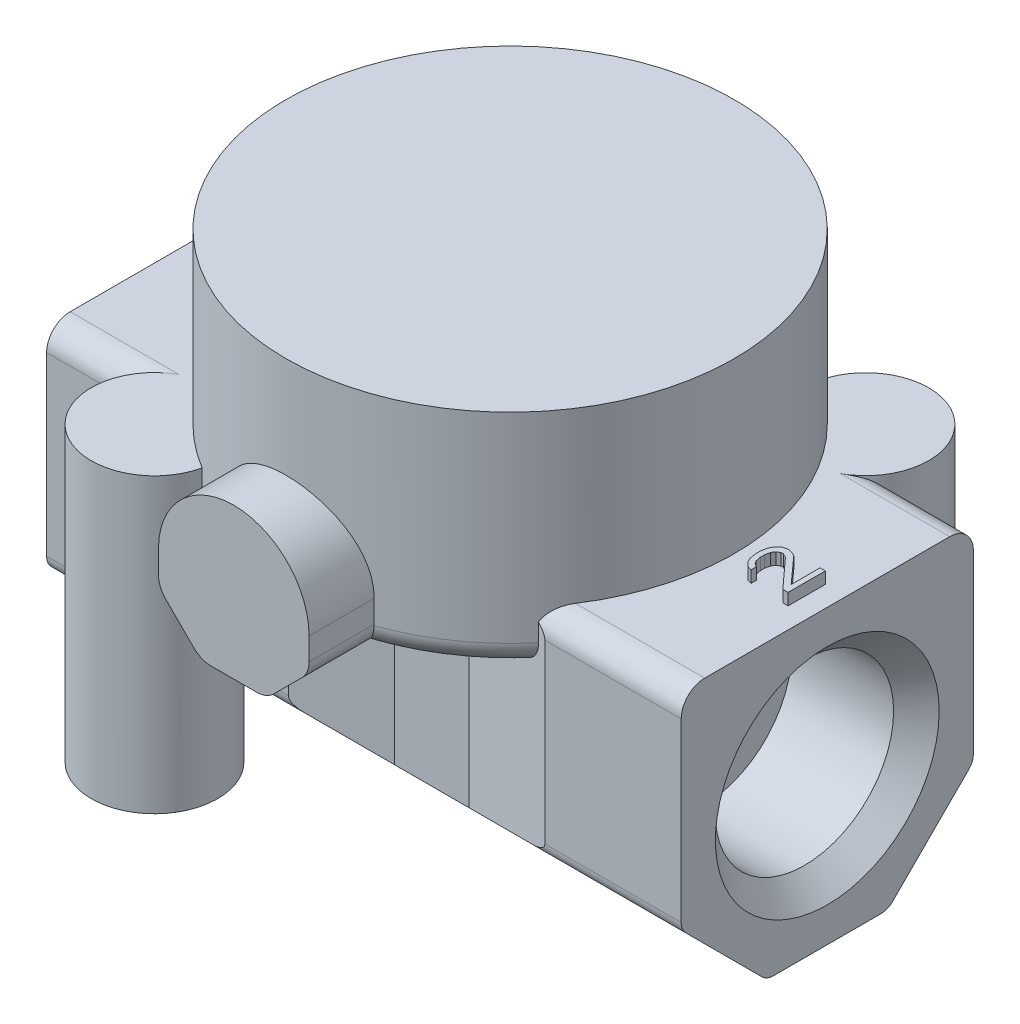
from build123d import *

# Parameters (mm, degrees)
BOSS_EXTRUDE1_DEPTH      = 39.612
CUT_EXTRUDE1_DEPTH       = 5.547195969
CUT_EXTRUDE1_DEPTH_BACK  = 5.547195969
CUT_EXTRUDE2_DEPTH       = 8.276160233
CUT_EXTRUDE2_DEPTH_BACK  = 8.276160233
SKETCH3_W                = 84.337272164
SKETCH3_H                = 65.415448281
SKETCH5_R                = 3.95
BOSS_EXTRUDE2_DEPTH      = 18.26969385
BOSS_EXTRUDE3_DEPTH      = 20
SKETCH7_R                = 3.937
BOSS_EXTRUDE4_DEPTH      = 18.26969385
BOSS_EXTRUDE5_DEPTH      = 0.7
BOSS_EXTRUDE5_DEPTH_BACK = 0.7
BOSS_EXTRUDE6_DEPTH      = 0.7
BOSS_EXTRUDE6_DEPTH_BACK = 0.7


with BuildPart() as part:
    # Sketch1 → Boss-Extrude1 (new body)
    with BuildSketch(Plane(origin=(19.8, 0, 0), x_dir=(0, 0, -1), z_dir=(1, 0, 0))):
        with BuildLine():
            Line((-8.826801422, -4.086394595), (-4.070394308, -8.842801555))
            ThreePointArc((-4.070394308, -8.842801555), (-3.745970956, -9.059574301), (-3.363287522, -9.135694762))
            Line((-3.363287522, -9.135694762), (3.363287818, -9.135694653))
            ThreePointArc((3.363287818, -9.135694653), (3.745971249, -9.059574179), (4.070394595, -8.842801423))
            Line((4.070394595, -8.842801423), (8.826801554, -4.086394309))
            ThreePointArc((8.826801554, -4.086394309), (9.043574313, -3.761970925), (9.119694762, -3.379287456))
            Line((9.119694762, -3.379287456), (9.119693846, 7.624000128))
            ThreePointArc((9.119693846, 7.624000128), (8.686301509, 8.6703016), (7.64, 9.10369385))
            Line((7.64, 9.10369385), (-7.650000004, 9.10369385))
            ThreePointArc((-7.650000004, 9.10369385), (-8.689230454, 8.673230525), (-9.119693854, 7.634000106))
            Line((-9.119693854, 7.634000106), (-9.119694652, -3.37928773))
            ThreePointArc((-9.119694652, -3.37928773), (-9.043574195, -3.761971209), (-8.826801422, -4.086394595))
        make_face()
    extrude(amount=-BOSS_EXTRUDE1_DEPTH)

    # Sketch2 → Cut-Extrude1 (cut, two sides: drawn at the far end of the back side and taken through both)
    with BuildSketch(Plane.XY.offset(-CUT_EXTRUDE1_DEPTH_BACK)):
        Polygon((-11.400000002, -16.447815487), (11.400000106, -16.447815487), (11.400000106, -9.166000001), (4.799999912, -7.366), (-4.8, -7.366), (-11.400000002, -9.166000001), align=None)
    extrude(amount=CUT_EXTRUDE1_DEPTH + CUT_EXTRUDE1_DEPTH_BACK, mode=Mode.SUBTRACT)

    # Sketch3 → Cut-Extrude2 (cut, two sides: drawn at the far end of the back side and taken through both)
    with BuildSketch(Plane(origin=(0, 0, 0), x_dir=(1, 0, 0), z_dir=(0, 1, 0)).offset(-CUT_EXTRUDE2_DEPTH_BACK)):
        with Locations((0.851814883, -0.975045123)):
            Rectangle(SKETCH3_W, SKETCH3_H)
        Polygon((-26.152859771, 16.921805373), (-26.152859771, -16.921805373), (0.145459355, -7.35), (4.799999991, -7.35), (30.199191541, -14.277051746), (30.199191541, 14.277052238), (4.8, 7.35), (0.145459355, 7.35), align=None, mode=Mode.SUBTRACT)
    extrude(amount=CUT_EXTRUDE2_DEPTH + CUT_EXTRUDE2_DEPTH_BACK, mode=Mode.SUBTRACT)

    # Sketch4 → Revolve1 (revolve)
    with BuildSketch(Plane(origin=(0, 0, 0), x_dir=(0, 0, -1), z_dir=(1, 0, 0)), mode=Mode.PRIVATE) as revolve1_sk:
        with BuildLine():
            Line((0, 19.65), (14.000000003, 19.65))
            Line((14.000000003, 19.65), (14.000000003, 7.149999997))
            ThreePointArc((14.000000003, 7.149999997), (13.560660172, 6.089339827), (12.5, 5.649999999))
            Line((12.5, 5.649999999), (0, 5.649999999))
            Line((0, 5.649999999), (0, 19.65))
        make_face()
    revolve(revolve1_sk.sketch.rotate(Axis((0, 5.649999999, 0), (0, 1, 0)), 180), axis=Axis((0, 5.649999999, 0), (0, 1, 0)))

    # Sketch5 → Boss-Extrude2 (add)
    with BuildSketch(Plane(origin=(0, -9.166, 0), x_dir=(-1, 0, 0), z_dir=(0, -1, 0))):
        with Locations(Location((11.1, -11.1, 0), (0, 0, 90))):
            Circle(SKETCH5_R)
    extrude(amount=-BOSS_EXTRUDE2_DEPTH)

    # Sketch6 → Boss-Extrude3 (add)
    with BuildSketch(Plane.XY.offset(17.25)):
        with BuildLine():
            Line((-4.7, 8.63), (-4.7, 7.231261469))
            ThreePointArc((-4.7, 7.231261469), (-4.583992408, 6.648051918), (-4.253630735, 6.153630735))
            Line((-4.253630735, 6.153630735), (-2.496369265, 4.396369265))
            ThreePointArc((-2.496369265, 4.396369265), (-2.001948082, 4.066007592), (-1.418738531, 3.95))
            Line((-1.418738531, 3.95), (1.418738531, 3.95))
            ThreePointArc((1.418738531, 3.95), (2.001948082, 4.066007592), (2.496369265, 4.396369265))
            Line((2.496369265, 4.396369265), (4.253630735, 6.153630735))
            ThreePointArc((4.253630735, 6.153630735), (4.583992408, 6.648051918), (4.7, 7.231261469))
            Line((4.7, 7.231261469), (4.7, 8.63))
            ThreePointArc((4.7, 8.63), (0, 13.350042553), (-4.7, 8.63))
        make_face()
    extrude(amount=-BOSS_EXTRUDE3_DEPTH)


with BuildPart() as boss_extrude4_tool:
    # Sketch7 → Boss-Extrude4 (new body)
    with BuildSketch(Plane(origin=(0, -9.166, 0), x_dir=(-1, 0, 0), z_dir=(0, -1, 0))):
        with Locations(Location((-11.1, 11.1, 0), (0, 0, 90))):
            Circle(SKETCH7_R)
    extrude(amount=-BOSS_EXTRUDE4_DEPTH)


with BuildPart() as part_1:
    add(part.part)


with BuildPart() as part_2:
    # Boss-Extrude4: joined with boss_extrude4_tool
    add(part_1.part.fuse(boss_extrude4_tool.part, tol=0.00001))

    # Sketch8 → Boss-Extrude5 (add, two sides: drawn at the far end of the back side and taken through both)
    with BuildSketch(Plane(origin=(0, 9.134, 0), x_dir=(1, 0, 0), z_dir=(0, 1, 0)).offset(-BOSS_EXTRUDE5_DEPTH_BACK)):
        Polygon((-15.2, -0.265), (-15.2, 0.1225), (-15.661702073, 0.51), (-16.189361769, 0.51), (-15.727659512, 0.1225), (-18.3, 0.1225), (-18.3, -0.265), align=None)
    extrude(amount=BOSS_EXTRUDE5_DEPTH + BOSS_EXTRUDE5_DEPTH_BACK)

    # Sketch9 → Boss-Extrude6 (add, two sides: drawn at the far end of the back side and taken through both)
    with BuildSketch(Plane(origin=(0, 9.134, 0), x_dir=(1, 0, 0), z_dir=(0, 1, 0)).offset(-BOSS_EXTRUDE6_DEPTH_BACK)):
        Polygon((18.5, -1.143), (18.5, 1.182), (18.170212759, 1.182), (18.170212759, -0.626333318), (16.719148964, 0.98825), (16.521276647, 1.117416728), (16.257446891, 1.182), (16.125531828, 1.182), (15.861702073, 1.117416728), (15.597872317, 0.859083272), (15.465957439, 0.60075), (15.4, 0.21325), (15.4, -0.045083364), (15.465957439, -0.497166682), (15.597872317, -0.7555), (15.861702073, -1.013833329), (16.125531828, -1.078416665), (16.125531828, -0.7555), (15.927659512, -0.626333318), (15.795744634, -0.432583318), (15.729787195, -0.109666636), (15.729787195, 0.148666636), (15.795744634, 0.471583272), (15.927659512, 0.665333272), (16.125531828, 0.7945), (16.257446891, 0.7945), (16.521276647, 0.665333272), (18.170212759, -1.143), align=None)
    extrude(amount=BOSS_EXTRUDE6_DEPTH + BOSS_EXTRUDE6_DEPTH_BACK)

    # Sketch10 → Cut-Revolve1 (revolve, cut)
    with BuildSketch(Plane(origin=(0, 0, -11.1), x_dir=(-1, 0, 0), z_dir=(0, 0, -1)), mode=Mode.PRIVATE) as cut_revolve1_sk:
        Polygon((-11.1125, -9.166), (-13.97, -9.166), (-13.208, -8.404), (-13.208, 0.484), (-11.1125, 1.743103427), align=None)
    revolve(cut_revolve1_sk.sketch.rotate(Axis((11.1125, 1.743206506, -11.1), (0, -1, 0)), 270), axis=Axis((11.1125, 1.743206506, -11.1), (0, -1, 0)), mode=Mode.SUBTRACT)

    # Sketch11 → Cut-Revolve2 (revolve, cut)
    with BuildSketch(Plane(origin=(0, 0, 11.1), x_dir=(-1, 0, 0), z_dir=(0, 0, -1)), mode=Mode.PRIVATE) as cut_revolve2_sk:
        Polygon((11.1125, -9.166), (8.317, -9.166), (9.0455, -8.4375), (9.0455, 0.501124528), (11.1125, 1.743103428), align=None)
    revolve(cut_revolve2_sk.sketch.rotate(Axis((-11.1125, 1.743206506, 11.1), (0, -1, 0)), 270), axis=Axis((-11.1125, 1.743206506, 11.1), (0, -1, 0)), mode=Mode.SUBTRACT)

    # Sketch12 → Cut-Revolve3 (revolve, cut)
    with BuildSketch(Plane(origin=(0, 0, 0), x_dir=(-1, 0, 0), z_dir=(0, 0, -1)), mode=Mode.PRIVATE) as cut_revolve3_sk:
        Polygon((12, 0), (12, 5.4991), (18.3111, 5.4991), (19.812, 7), (19.812, 0), align=None)
    revolve(cut_revolve3_sk.sketch.rotate(Axis((-19.812, 0, 0), (1, 0, 0)), 270), axis=Axis((-19.812, 0, 0), (1, 0, 0)), mode=Mode.SUBTRACT)

    # Sketch13 → Cut-Revolve4 (revolve, cut)
    with BuildSketch(Plane(origin=(0, 0, 0), x_dir=(-1, 0, 0), z_dir=(0, 0, -1)), mode=Mode.PRIVATE) as cut_revolve4_sk:
        Polygon((-19.8, 0), (-19.8, 6.985), (-18.3776, 5.5626), (-12, 5.5626), (-12, 0), align=None)
    revolve(cut_revolve4_sk.sketch.rotate(Axis((12, 0, 0), (1, 0, 0)), 270), axis=Axis((12, 0, 0), (1, 0, 0)), mode=Mode.SUBTRACT)


solid = part_2.part
